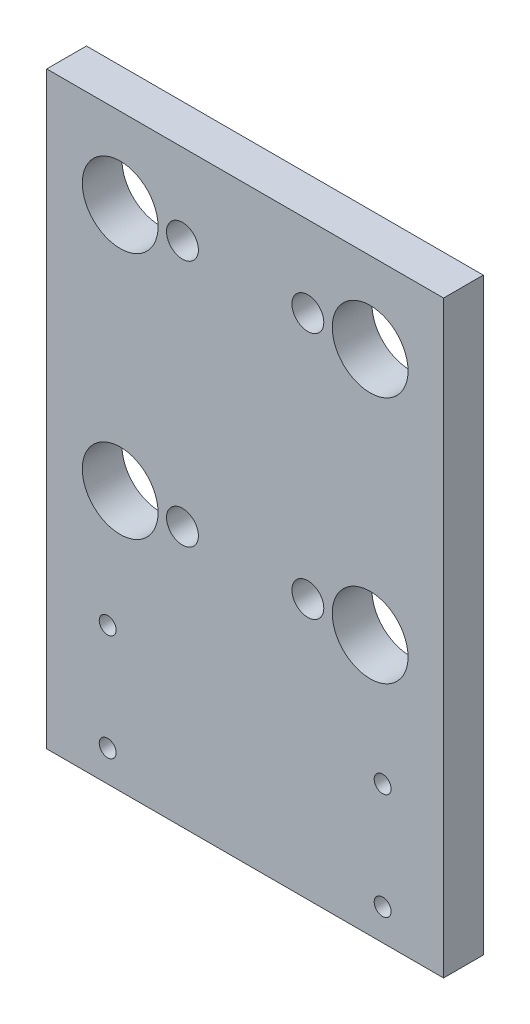
from build123d import *

# Parameters (mm, degrees)
SKETCH1_W           = 6.35
SKETCH1_H           = 94.234
BOSS_EXTRUDE1_DEPTH = 31.75
SKETCH15_R          = 2.55
SKETCH15_R_2        = 6.064
CUT_EXTRUDE8_DEPTH  = 58.169893204
SKETCH16_R          = 1.35255
CUT_EXTRUDE9_DEPTH  = 58.169893204
SKETCH17_R          = 5.08
CUT_EXTRUDE10_DEPTH = 2.032


with BuildPart() as part:
    # Sketch1 → Boss-Extrude1 (new, symmetric)
    with BuildSketch(Plane(origin=(0, 0, 0), x_dir=(0, 0, -1), z_dir=(1, 0, 0))):
        with Locations((3.175, 0)):
            Rectangle(SKETCH1_W, SKETCH1_H)
    extrude(amount=BOSS_EXTRUDE1_DEPTH, both=True)

    # Sketch15 → Cut-Extrude8 (cut, through all)
    with BuildSketch(Plane.XY):
        with Locations((10.033, 34.163)):
            Circle(SKETCH15_R)
        with Locations((10.033, -5.461)):
            Circle(SKETCH15_R)
        with Locations((-10.033, -5.461)):
            Circle(SKETCH15_R)
        with Locations((-10.033, 34.163)):
            Circle(SKETCH15_R)
        with Locations((-20, 34.163)):
            Circle(SKETCH15_R_2)
        with Locations((20, 34.163)):
            Circle(SKETCH15_R_2)
        with Locations((20, -5.461)):
            Circle(SKETCH15_R_2)
        with Locations((-20, -5.461)):
            Circle(SKETCH15_R_2)
    extrude(amount=-CUT_EXTRUDE8_DEPTH, mode=Mode.SUBTRACT)

    # Sketch16 → Cut-Extrude9 (cut, through all)
    with BuildSketch(Plane(origin=(0, 0, -6.35), x_dir=(-1, 0, 0), z_dir=(0, 0, -1))):
        with Locations((-22, -25.099)):
            Circle(SKETCH16_R)
        with Locations((22, -25.099)):
            Circle(SKETCH16_R)
        with Locations((22, -42.117)):
            Circle(SKETCH16_R)
        with Locations((-22, -42.117)):
            Circle(SKETCH16_R)
    extrude(amount=-CUT_EXTRUDE9_DEPTH, mode=Mode.SUBTRACT)

    # Sketch17 → Cut-Extrude10 (cut)
    with BuildSketch(Plane(origin=(0, 0, -6.35), x_dir=(-1, 0, 0), z_dir=(0, 0, -1))):
        with Locations((-22, -25.099)):
            Circle(SKETCH17_R)
        with Locations((22, -25.099)):
            Circle(SKETCH17_R)
        with BuildLine():
            Line((-27.08, -42.117), (-27.08, -47.117))
            Line((-27.08, -47.117), (-16.92, -47.117))
            Line((-16.92, -47.117), (-16.92, -42.117))
            ThreePointArc((-16.92, -42.117), (-22, -37.037), (-27.08, -42.117))
        make_face()
        with BuildLine():
            Line((16.92, -42.117), (16.92, -47.117))
            Line((16.92, -47.117), (27.08, -47.117))
            Line((27.08, -47.117), (27.08, -42.117))
            ThreePointArc((27.08, -42.117), (22, -37.037), (16.92, -42.117))
        make_face()
    extrude(amount=-CUT_EXTRUDE10_DEPTH, mode=Mode.SUBTRACT)


solid = part.part
